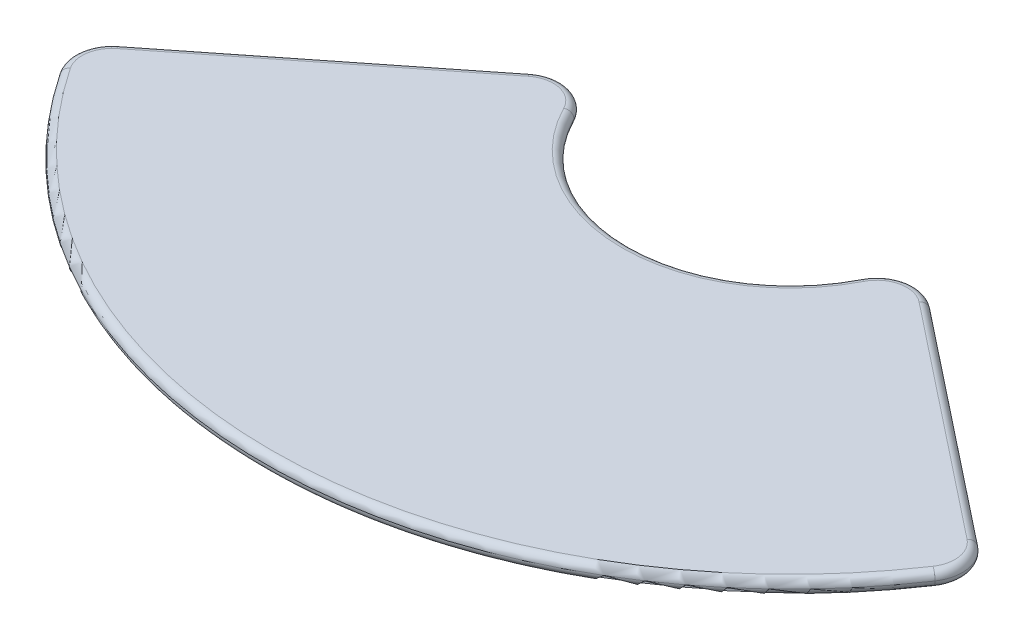
from build123d import *

# Parameters (mm, degrees)
BOSS_EXTRUDE1_DEPTH = 4
FILLET1_R           = 2


with BuildPart() as part:
    # Sketch19 → Boss-Extrude1 (new body)
    with BuildSketch(Plane(origin=(0, 52, 0), x_dir=(1, 0, 0), z_dir=(0, 1, 0))):
        with BuildLine():
            Line((-53.176611718, 91.877251824), (-114.16950438, 43.635670657))
            ThreePointArc((-114.16950438, 43.635670657), (-117.84473403, 37.344982568), (-116.276319478, 30.230198988))
            ThreePointArc((-116.276319478, 30.230198988), (0, -31.862084944), (116.276319478, 30.230198988))
            ThreePointArc((116.276319478, 30.230198988), (117.84473403, 37.344982568), (114.16950438, 43.635670657))
            Line((114.16950438, 43.635670657), (53.176611718, 91.877251824))
            ThreePointArc((53.176611718, 91.877251824), (44.845069921, 93.804963904), (38.069768681, 88.587114185))
            ThreePointArc((38.069768681, 88.587114185), (0, 65.296707731), (-38.069768681, 88.587114185))
            ThreePointArc((-38.069768681, 88.587114185), (-44.845069921, 93.804963904), (-53.176611718, 91.877251824))
        make_face()
    extrude(amount=BOSS_EXTRUDE1_DEPTH)

    # Fillet1
    fillet1_edges = [part.edges().sort_by_distance(p)[0] for p in [
        (-83.673058049, 52, -67.75646124),
        (-117.84473403, 52, -37.344982568),
        (0, 52, 31.862084944),
        (117.84473403, 52, -37.344982568),
        (83.673058049, 52, -67.75646124),
        (44.845069921, 52, -93.804963904),
        (0, 52, -65.296707731),
        (-44.845069921, 52, -93.804963904),
        (0, 56, -65.296707731),
        (44.845069921, 56, -93.804963904),
        (83.673058049, 56, -67.75646124),
        (117.84473403, 56, -37.344982568),
        (0, 56, 31.862084944),
        (-117.84473403, 56, -37.344982568),
        (-83.673058049, 56, -67.75646124),
        (-44.845069921, 56, -93.804963904),
    ]]
    fillet(fillet1_edges, radius=FILLET1_R - 0.0001)  # a hair under: the kernel refuses the full size


solid = part.part
